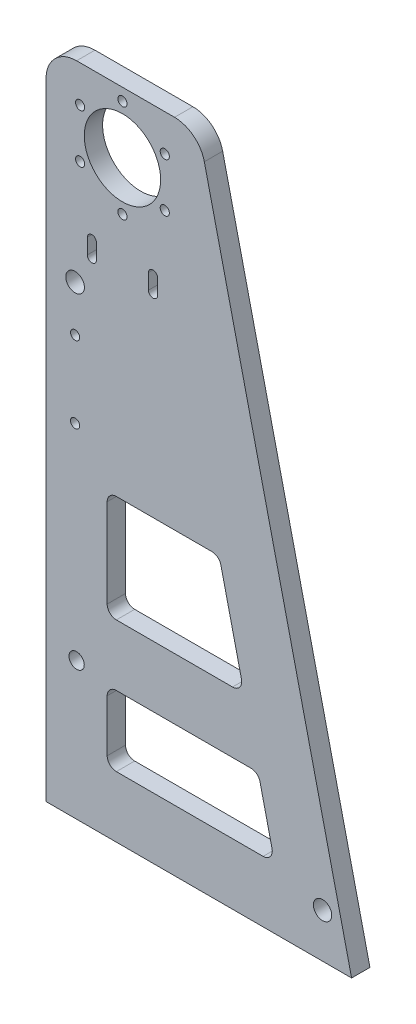
from build123d import *

# Parameters (mm, degrees)
ESBO_O1_R                = 12.5
ESBO_O1_R_2              = 1.5
ESBO_O1_R_3              = 2.5
RESSALTO_EXTRUS_O2_DEPTH = 6
FILETE1_R                = 10
ESBO_O2_R                = 1.5
ESBO_O2_R_2              = 3
ESBO_O2_R_3              = 3.05
CORTE_EXTRUS_O1_DEPTH    = 238.194013415


with BuildPart() as part:
    # Esboço1 → Ressalto-extrusão2 (new body)
    with BuildSketch(Plane.XY):
        Polygon((0, 0), (0, 215), (50, 215), (100, 0), align=None)
        with Locations((25, 195)):
            Circle(ESBO_O1_R, mode=Mode.SUBTRACT)
        with Locations((25, 211)):
            Circle(ESBO_O1_R_2, mode=Mode.SUBTRACT)
        with Locations((38.856406461, 203)):
            Circle(ESBO_O1_R_2, mode=Mode.SUBTRACT)
        with Locations((38.856406461, 187)):
            Circle(ESBO_O1_R_2, mode=Mode.SUBTRACT)
        with Locations((25, 179)):
            Circle(ESBO_O1_R_2, mode=Mode.SUBTRACT)
        with Locations((11.143593539, 187)):
            Circle(ESBO_O1_R_2, mode=Mode.SUBTRACT)
        with Locations((11.143593539, 203)):
            Circle(ESBO_O1_R_2, mode=Mode.SUBTRACT)
        with Locations((10, 45)):
            Circle(ESBO_O1_R_3, mode=Mode.SUBTRACT)
        with BuildLine():
            Line((20, 95), (20, 66))
            ThreePointArc((20, 66), (20.878679656, 63.878679656), (23, 63))
            Line((23, 63), (61.03739436, 63))
            ThreePointArc((61.03739436, 63), (63.386715693, 64.134339454), (63.959418441, 66.679540484))
            Line((63.959418441, 66.679540484), (57.215232395, 95.679540484))
            ThreePointArc((57.215232395, 95.679540484), (56.15886886, 97.349321333), (54.293208314, 98))
            Line((54.293208314, 98), (23, 98))
            ThreePointArc((23, 98), (20.878679656, 97.121320344), (20, 95))
        make_face(mode=Mode.SUBTRACT)
        with BuildLine():
            Line((20, 40), (20, 23))
            ThreePointArc((20, 23), (20.878679656, 20.878679656), (23, 20))
            Line((23, 20), (71.03739436, 20))
            ThreePointArc((71.03739436, 20), (73.386715693, 21.134339454), (73.959418441, 23.679540484))
            Line((73.959418441, 23.679540484), (70.005930069, 40.679540484))
            ThreePointArc((70.005930069, 40.679540484), (68.949566534, 42.349321333), (67.083905988, 43))
            Line((67.083905988, 43), (23, 43))
            ThreePointArc((23, 43), (20.878679656, 42.121320344), (20, 40))
        make_face(mode=Mode.SUBTRACT)
    extrude(amount=RESSALTO_EXTRUS_O2_DEPTH)

    # Filete1
    filete1_edges = [part.edges().sort_by_distance(p)[0] for p in [
        (0, 215, 3),
        (50, 215, 3),
    ]]
    fillet(filete1_edges, radius=FILETE1_R)

    # Esboço2 → Corte-extrusão1 (cut, through all)
    with BuildSketch(Plane.XY.offset(6)):
        with Locations((9.5, 137)):
            Circle(ESBO_O2_R)
        with Locations((90.5, 14.5)):
            Circle(ESBO_O2_R_2)
        with Locations((9.5, 112)):
            Circle(ESBO_O2_R)
        with Locations((9.5, 152)):
            Circle(ESBO_O2_R_3)
        with BuildLine():
            Line((13.5, 161.71), (13.5, 166.71))
            ThreePointArc((13.5, 166.71), (15, 168.21), (16.5, 166.71))
            Line((16.5, 166.71), (16.5, 161.71))
            ThreePointArc((16.5, 161.71), (15, 160.21), (13.5, 161.71))
        make_face()
        with BuildLine():
            Line((33.5, 161.71), (33.5, 166.71))
            ThreePointArc((33.5, 166.71), (35, 168.21), (36.5, 166.71))
            Line((36.5, 166.71), (36.5, 161.71))
            ThreePointArc((36.5, 161.71), (35, 160.21), (33.5, 161.71))
        make_face()
    extrude(amount=-CORTE_EXTRUS_O1_DEPTH, mode=Mode.SUBTRACT)


solid = part.part
